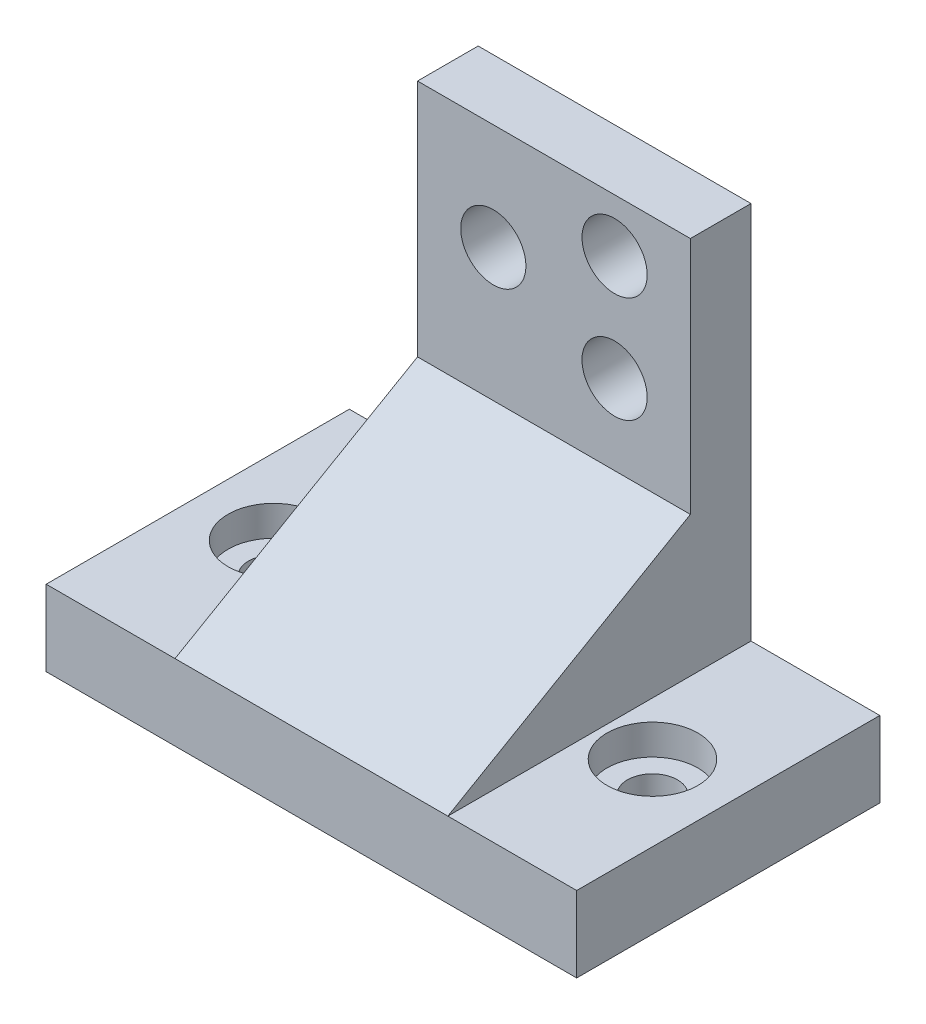
from build123d import *

# Parameters (mm, degrees)
SKETCH1_W           = 35
SKETCH1_H           = 20
SKETCH1_R           = 1.65
BOSS_EXTRUDE1_DEPTH = 5
SKETCH3_W           = 18
SKETCH3_H           = 4
BOSS_EXTRUDE2_DEPTH = 25
CUT_EXTRUDE1_REACH  = 40.239
SKETCH4_R           = 2.15
SKETCH5_R           = 3
CUT_EXTRUDE2_DEPTH  = 2
CHAMFER1_SIZE2      = 9.237604307
CHAMFER1_SIZE       = 16


with BuildPart() as part:
    # Sketch1 → Boss-Extrude1 (new body)
    with BuildSketch(Plane(origin=(0, 0, 0), x_dir=(1, 0, 0), z_dir=(0, 1, 0))):
        Rectangle(SKETCH1_W, SKETCH1_H)
        with Locations(Location((-12.5, 0, 0), (0, 0, 270))):
            Circle(SKETCH1_R, mode=Mode.SUBTRACT)
        with Locations(Location((12.5, 0, 0), (0, 0, 90))):
            Circle(SKETCH1_R, mode=Mode.SUBTRACT)
    extrude(amount=BOSS_EXTRUDE1_DEPTH)

    # Sketch3 → Boss-Extrude2 (add)
    with BuildSketch(Plane(origin=(0, 5, 0), x_dir=(1, 0, 0), z_dir=(0, 1, 0))):
        with Locations((0, 8)):
            Rectangle(SKETCH3_W, SKETCH3_H)
    extrude(amount=BOSS_EXTRUDE2_DEPTH)

    # Sketch4 → Cut-Extrude1 (cut, up to next)
    with BuildSketch(Plane.XY.offset(-6), mode=Mode.PRIVATE) as cut_extrude1_sk1:
        with Locations((-4, 23)):
            Circle(SKETCH4_R)
    cut_extrude1_tool1 = extrude(cut_extrude1_sk1.sketch, amount=-CUT_EXTRUDE1_REACH, mode=Mode.PRIVATE) & part.part
    # Sketch4 → Cut-Extrude1 (cut, up to next)
    with BuildSketch(Plane.XY.offset(-6), mode=Mode.PRIVATE) as cut_extrude1_sk2:
        with Locations((4, 26.5)):
            Circle(SKETCH4_R)
    cut_extrude1_tool2 = extrude(cut_extrude1_sk2.sketch, amount=-CUT_EXTRUDE1_REACH, mode=Mode.PRIVATE) & part.part
    # Sketch4 → Cut-Extrude1 (cut, up to next)
    with BuildSketch(Plane.XY.offset(-6), mode=Mode.PRIVATE) as cut_extrude1_sk3:
        with Locations((4, 19.5)):
            Circle(SKETCH4_R)
    cut_extrude1_tool3 = extrude(cut_extrude1_sk3.sketch, amount=-CUT_EXTRUDE1_REACH, mode=Mode.PRIVATE) & part.part
    add(cut_extrude1_tool1.solids().sort_by_distance((-4, 23, -6))[0], mode=Mode.SUBTRACT)
    add(cut_extrude1_tool2.solids().sort_by_distance((4, 26.5, -6))[0], mode=Mode.SUBTRACT)
    add(cut_extrude1_tool3.solids().sort_by_distance((4, 19.5, -6))[0], mode=Mode.SUBTRACT)

    # Sketch5 → Cut-Extrude2 (cut)
    with BuildSketch(Plane(origin=(0, 5, 0), x_dir=(1, 0, 0), z_dir=(0, 1, 0))):
        with Locations(Location((-12.5, 0, 0), (0, 0, 270))):
            Circle(SKETCH5_R)
        with Locations(Location((12.5, 0, 0), (0, 0, 90))):
            Circle(SKETCH5_R)
    extrude(amount=-CUT_EXTRUDE2_DEPTH, mode=Mode.SUBTRACT)

    # Chamfer1
    chamfer1_edges = [part.edges().sort_by_distance(p)[0] for p in [
        (0, 5, -6),
    ]]
    chamfer1_side = [part.faces().sort_by_distance(p)[0] for p in [
        (0, 5, -5.815247914),
    ]]
    chamfer(chamfer1_edges, length=CHAMFER1_SIZE - 0.0001, length2=CHAMFER1_SIZE2 - 0.0001, reference=chamfer1_side[0])  # a hair under: the kernel refuses the full size


solid = part.part
